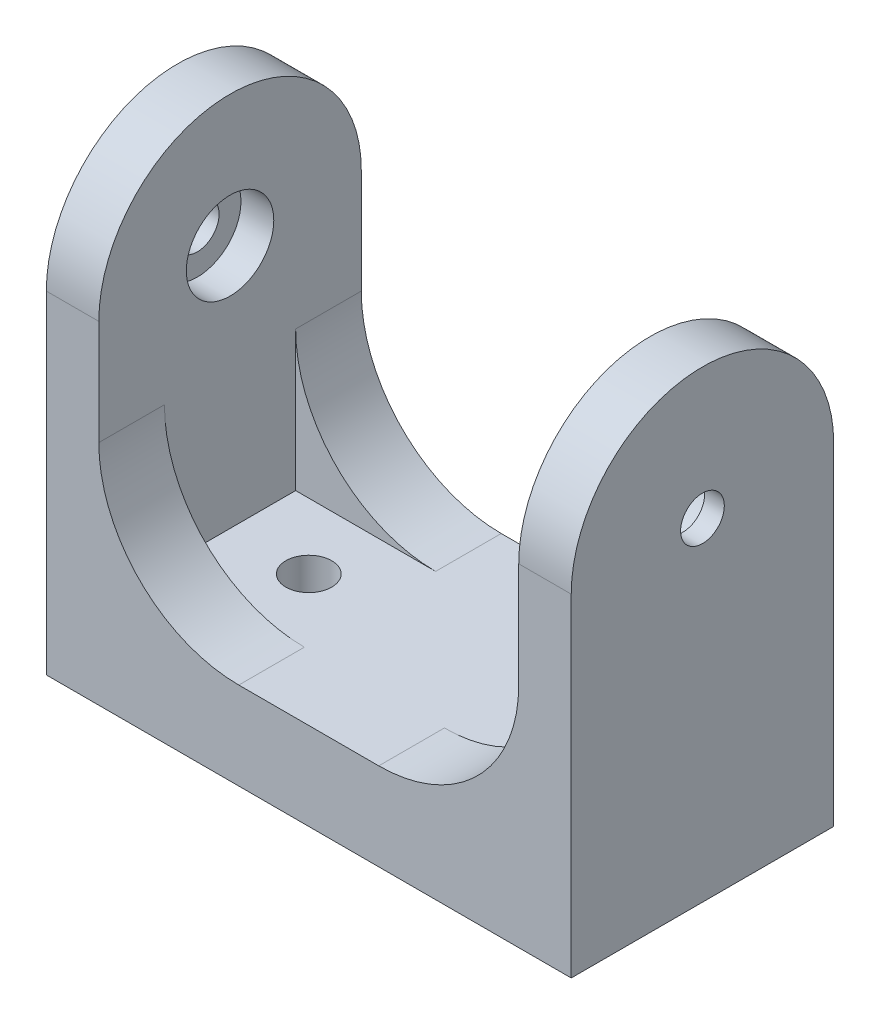
from build123d import *

# Parameters (mm, degrees)
SKETCH1_W           = 76.2
SKETCH1_H           = 38.1
SKETCH1_R           = 3.3274
BOSS_EXTRUDE1_DEPTH = 12.7
SKETCH5_R           = 3.175
BOSS_EXTRUDE3_DEPTH = 7.62
FILLET3_START       = -15.722599236
FILLET3_DEPTH       = 15.722599236
FILLET3_START_2     = -38.1
FILLET3_2_DEPTH     = 15.722595954
FILLET3_START_3     = -22.377404046
FILLET3_3_DEPTH     = 6.65480481
FILLET3_START_4     = 12.7
FILLET3_4_OUTLINE_R = 3.3274
FILLET3_4_DEPTH     = 20.32
SKETCH11_W          = 25.4
SKETCH11_H          = 19.05
CUT_EXTRUDE2_DEPTH  = 102.194377846
SKETCH13_R          = 6.35
CUT_EXTRUDE3_DEPTH  = 4.7625


with BuildPart() as part:
    # Sketch1 → Boss-Extrude1 (new body)
    with BuildSketch(Plane(origin=(0, 0, 0), x_dir=(1, 0, 0), z_dir=(0, 1, 0))):
        with Locations((38.1, 19.05)):
            Rectangle(SKETCH1_W, SKETCH1_H)
        with Locations(Location((19.05, 19.05, 0), (0, 0, 270))):
            Circle(SKETCH1_R, mode=Mode.SUBTRACT)
        with Locations(Location((57.15, 19.05, 0), (0, 0, 90))):
            Circle(SKETCH1_R, mode=Mode.SUBTRACT)
    extrude(amount=BOSS_EXTRUDE1_DEPTH)

    # Sketch5 → Boss-Extrude3 (add)
    with BuildSketch(Plane.ZY):
        with BuildLine():
            Line((-38.1, 12.7), (0, 12.7))
            Line((0, 12.7), (0, 48.26))
            ThreePointArc((0, 48.26), (-19.05, 67.31), (-38.1, 48.26))
            Line((-38.1, 48.26), (-38.1, 12.7))
        make_face()
        with Locations((-19.05, 48.26)):
            Circle(SKETCH5_R, mode=Mode.SUBTRACT)
    boss_extrude3 = extrude(amount=-BOSS_EXTRUDE3_DEPTH)

    # Fillet3: read off the stored shape, not the designer's step
    # Fillet3 outline → Fillet3 (add)
    with BuildSketch(Plane.XY.offset(FILLET3_START)):
        with BuildLine():
            Line((7.62, 12.7), (27.94, 12.7))
            ThreePointArc((27.94, 12.7), (13.571590206, 18.651590206), (7.62, 33.02))
            Line((7.62, 33.02), (7.62, 12.7))
        make_face()
    fillet3 = extrude(amount=FILLET3_DEPTH)

    # Fillet3 2 outline → Fillet3 2 (add)
    with BuildSketch(Plane.XY.offset(FILLET3_START_2)):
        with BuildLine():
            Line((7.62, 12.7), (27.94, 12.7))
            ThreePointArc((27.94, 12.7), (13.571590206, 18.651590206), (7.62, 33.02))
            Line((7.62, 33.02), (7.62, 12.7))
        make_face()
    fillet3_2 = extrude(amount=FILLET3_2_DEPTH)

    # Fillet3 3 outline → Fillet3 3 (add)
    with BuildSketch(Plane.XY.offset(FILLET3_START_3)):
        with BuildLine():
            Line((7.62, 12.7), (27.94, 12.7))
            ThreePointArc((27.94, 12.7), (13.571590206, 18.651590206), (7.62, 33.02))
            Line((7.62, 33.02), (7.62, 12.7))
        make_face()
    fillet3_3 = extrude(amount=FILLET3_3_DEPTH)

    # Fillet3 4 outline → Fillet3 4 (cut)
    with BuildSketch(Plane(origin=(0, 0, 0), x_dir=(1, 0, 0), z_dir=(0, 1, 0)).offset(FILLET3_START_4)):
        with Locations((19.05, 19.05)):
            Circle(FILLET3_4_OUTLINE_R)
    fillet3_4 = extrude(amount=FILLET3_4_DEPTH, mode=Mode.SUBTRACT)

    # Sketch11 → Cut-Extrude2 (cut, through all)
    with BuildSketch(Plane(origin=(0, 12.7, 0), x_dir=(1, 0, 0), z_dir=(0, 1, 0))):
        with Locations((20.32, 19.05)):
            Rectangle(SKETCH11_W, SKETCH11_H)
    cut_extrude2 = extrude(amount=CUT_EXTRUDE2_DEPTH, mode=Mode.SUBTRACT)

    # Sketch13 → Cut-Extrude3 (cut)
    with BuildSketch(Plane(origin=(7.62, 0, 0), x_dir=(0, 0, -1), z_dir=(1, 0, 0))):
        with Locations((19.05, 48.26)):
            Circle(SKETCH13_R)
    cut_extrude3 = extrude(amount=-CUT_EXTRUDE3_DEPTH, mode=Mode.SUBTRACT)

    # Mirror3: Boss-Extrude3, Fillet3, Fillet3 2, Fillet3 3, Fillet3 4 across plane
    add(boss_extrude3.mirror(Plane(origin=(38.1, 0, 0), x_dir=(0, 0, 1), z_dir=(1, 0, 0))))
    add(fillet3.mirror(Plane(origin=(38.1, 0, 0), x_dir=(0, 0, 1), z_dir=(1, 0, 0))))
    add(fillet3_2.mirror(Plane(origin=(38.1, 0, 0), x_dir=(0, 0, 1), z_dir=(1, 0, 0))))
    add(fillet3_3.mirror(Plane(origin=(38.1, 0, 0), x_dir=(0, 0, 1), z_dir=(1, 0, 0))))
    add(fillet3_4.mirror(Plane(origin=(38.1, 0, 0), x_dir=(0, 0, 1), z_dir=(1, 0, 0))), mode=Mode.SUBTRACT)

    # Mirror4: Cut-Extrude2 across plane
    add(cut_extrude2.mirror(Plane(origin=(38.1, 0, 0), x_dir=(0, 0, 1), z_dir=(1, 0, 0))), mode=Mode.SUBTRACT)

    # Mirror5: Cut-Extrude3 across plane
    add(cut_extrude3.mirror(Plane(origin=(38.1, 0, 0), x_dir=(0, 0, 1), z_dir=(1, 0, 0))), mode=Mode.SUBTRACT)


solid = part.part
